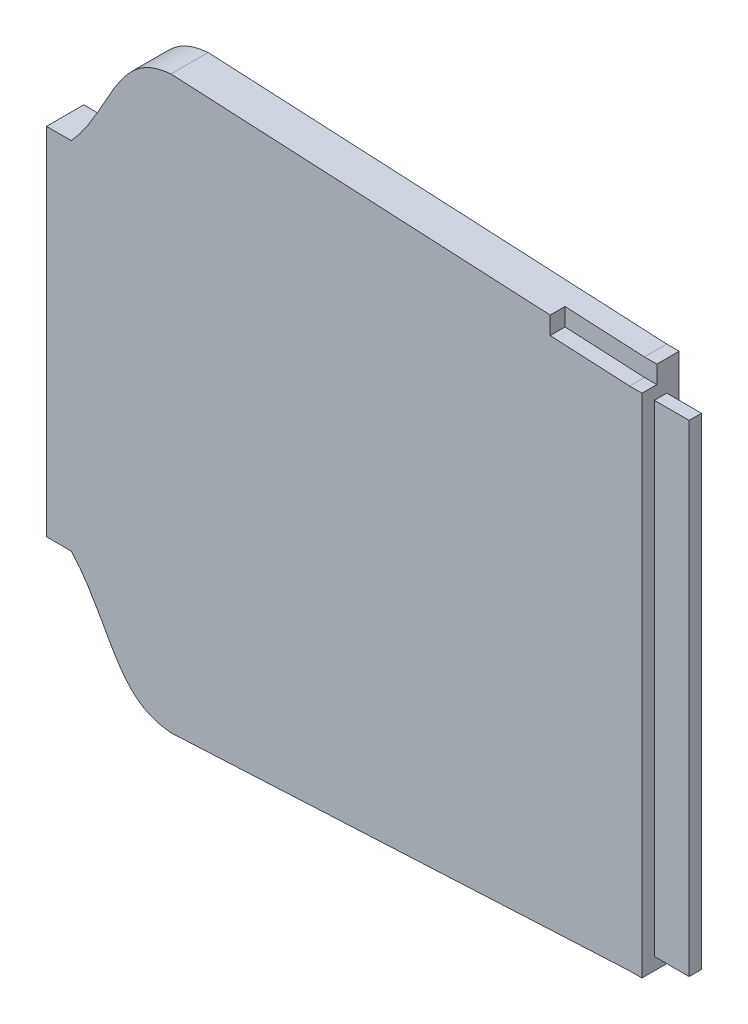
from build123d import *

# Parameters (mm, degrees)
STOCK_BATTERY_BASE_1_DEPTH   = 7.5
STOCK_BATTERY_BASE_1_2_DEPTH = 4.5
BOSS_EXTRUDE1_DEPTH          = 2.5
SKETCH2_W                    = 2.5
SKETCH2_H                    = 97.061474856
BOSS_EXTRUDE2_DEPTH          = 7


# Read off the part's stored shape, not the designer's step: Stock-battery base-1
with BuildPart() as part:
    # Stock-battery base-1 outline → Stock-battery base-1 (new body)
    with BuildSketch(Plane.XY):
        with BuildLine():
            Line((16.459100066, -58.832087736), (16.459100066, 43.22938712))
            Line((16.459100066, 43.22938712), (0.459100066, 44.038083245))
            Line((0.459100066, 44.038083245), (0.459100066, 47.61329436))
            Line((0.459100066, 47.61329436), (-75.963345356, 51.475952827))
            add(Edge.make_bspline(
                [(-75.963345356, 51.475952827), (-76.969760945, 51.385311169), (-77.956664013, 51.213742336), (-79.395866789, 50.78571401), (-79.86970863, 50.613871194), (-80.796837185, 50.204577199), (-81.240590365, 49.971323111), (-82.089787414, 49.449496549), (-82.495246976, 49.160946736), (-83.271465049, 48.533739024), (-83.643007435, 48.194375714), (-84.708444042, 47.116795042), (-85.333215001, 46.343374139), (-86.491296884, 44.737676097), (-87.023827607, 43.904896882), (-88.044872363, 42.211012893), (-88.533034054, 41.34968138), (-89.982900727, 38.756279626), (-90.93240726, 37.013628654), (-92.999467157, 33.650383947), (-94.114586107, 32.031232641), (-95.60337212, 30.287705281), (-95.819744565, 30.042891916), (-96.040899934, 29.801740739)],
                knots=[0, 0, 0, 0, 0.0625, 0.0625, 0.09375, 0.09375, 0.125, 0.125, 0.15625, 0.15625, 0.1875, 0.1875, 0.25, 0.25, 0.3125, 0.3125, 0.375, 0.375, 0.5, 0.5, 0.625, 0.625, 0.645748558, 0.645748558, 0.645748558, 0.645748558], degree=3))
            Line((-96.040899934, 29.801740739), (-101.040899934, 29.801740739))
            Line((-101.040899934, 29.801740739), (-101.040899934, -41.829259963))
            Line((-101.040899934, -41.829259963), (-96.040899934, -41.829259963))
            add(Edge.make_bspline(
                [(-96.040899934, -41.829259963), (-95.798899268, -42.093160096), (-95.56197213, -42.362136183), (-94.03954966, -44.156758027), (-92.923608678, -45.792412437), (-90.858487716, -49.170948695), (-89.911065512, -50.914960796), (-88.457766632, -53.51029646), (-87.967520262, -54.371999904), (-86.940892781, -56.06392928), (-86.404912323, -56.894254814), (-85.530671439, -58.091259413), (-85.227414802, -58.482089731), (-84.588818098, -59.241614046), (-84.254184704, -59.609132259), (-83.204929916, -60.651600397), (-82.440569541, -61.270576891), (-81.160629249, -62.042718444), (-80.719255742, -62.269433113), (-79.817314106, -62.660888928), (-79.3554021, -62.826549047), (-77.940467092, -63.243286827), (-76.954208328, -63.414201398), (-75.963345356, -63.503442328)],
                knots=[0.352672192, 0.352672192, 0.352672192, 0.352672192, 0.375, 0.375, 0.5, 0.5, 0.625, 0.625, 0.6875, 0.6875, 0.75, 0.75, 0.78125, 0.78125, 0.8125, 0.8125, 0.875, 0.875, 0.90625, 0.90625, 0.9375, 0.9375, 1, 1, 1, 1], degree=3))
            Line((-75.963345356, -63.503442328), (16.459100066, -58.832087736))
        make_face()
    extrude(amount=STOCK_BATTERY_BASE_1_DEPTH)

    # Stock-battery base-1 2 outline → Stock-battery base-1 2 (add)
    with BuildSketch(Plane.XY):
        Polygon((16.459100066, 43.22938712), (16.459100066, 46.804598235), (0.459100066, 47.61329436), (0.459100066, 44.038083245), align=None)
    extrude(amount=STOCK_BATTERY_BASE_1_2_DEPTH)

    # Sketch1 → Boss-Extrude1 (add)
    with BuildSketch(Plane(origin=(16.459100066, 0, 0), x_dir=(0, 0, -1), z_dir=(1, 0, 0))):
        Polygon((0, -58.832087736), (0, 46.804598235), (-4.5, 46.804598235), (-4.5, 43.22938712), (-7.5, 43.22938712), (-7.5, -58.832087736), align=None)
    extrude(amount=BOSS_EXTRUDE1_DEPTH)

    # Sketch2 → Boss-Extrude2 (add)
    with BuildSketch(Plane(origin=(18.959100066, 0, 0), x_dir=(0, 0, -1), z_dir=(1, 0, 0))):
        with Locations((-3.75, -7.801350308)):
            Rectangle(SKETCH2_W, SKETCH2_H)
    extrude(amount=BOSS_EXTRUDE2_DEPTH)


solid = part.part
